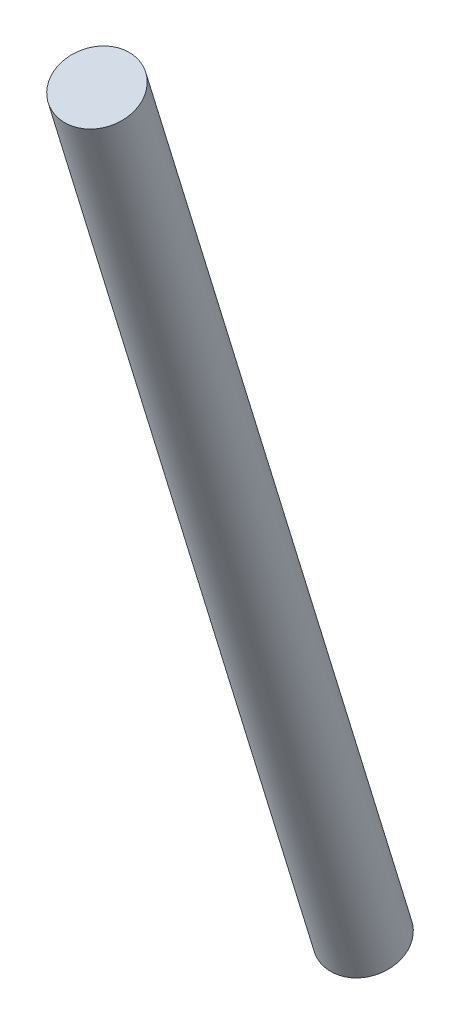
from build123d import *

# Parameters (mm, degrees)
SWEEP1_PROFILE_R = 17.145


with BuildPart() as part:
    # Sweep1: sweep along a curve in space
    with BuildLine() as sweep1_path:
        Line((164.278526781, 112.063669757, 175.582551715), (208.728526781, 568.237895888, 346.22225237))
    # Sweep1 profile (on start of the path) → Sweep1 (sweep)
    with BuildSketch(Plane(origin=(164.278526781, 112.063669757, 175.582551715), x_dir=(0, -0.3503571552002772, 0.9366161774173929), z_dir=(0.09088694288539863, 0.932739726346261, 0.3489071029779254))):
        Circle(SWEEP1_PROFILE_R)
    sweep(path=sweep1_path.line)


solid = part.part
